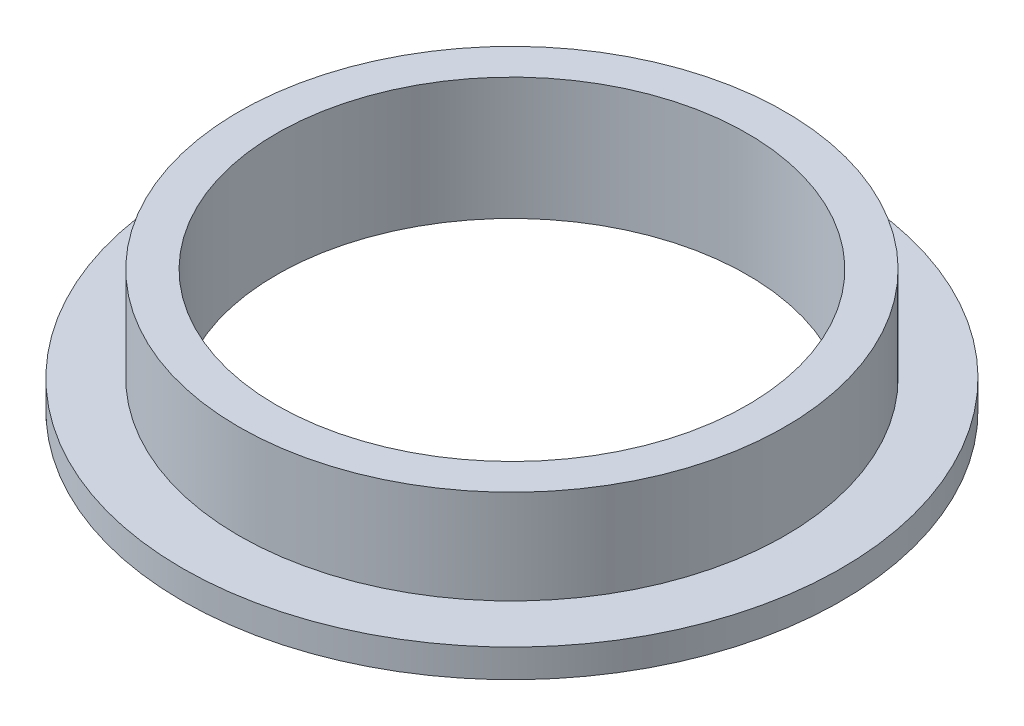
from build123d import *

# Parameters (mm, degrees)
SKETCH1_R           = 35
SKETCH1_R_2         = 25
BOSS_EXTRUDE1_DEPTH = 3
SKETCH2_R           = 29
SKETCH2_R_2         = 25
BOSS_EXTRUDE2_DEPTH = 10


with BuildPart() as part:
    # Sketch1 → Boss-Extrude1 (new body)
    with BuildSketch(Plane(origin=(0, 0, 0), x_dir=(1, 0, 0), z_dir=(0, 1, 0))):
        Circle(SKETCH1_R)
        Circle(SKETCH1_R_2, mode=Mode.SUBTRACT)
    extrude(amount=BOSS_EXTRUDE1_DEPTH)

    # Sketch2 → Boss-Extrude2 (add)
    with BuildSketch(Plane(origin=(0, 3, 0), x_dir=(1, 0, 0), z_dir=(0, 1, 0))):
        Circle(SKETCH2_R)
        Circle(SKETCH2_R_2, mode=Mode.SUBTRACT)
    extrude(amount=BOSS_EXTRUDE2_DEPTH)


solid = part.part
